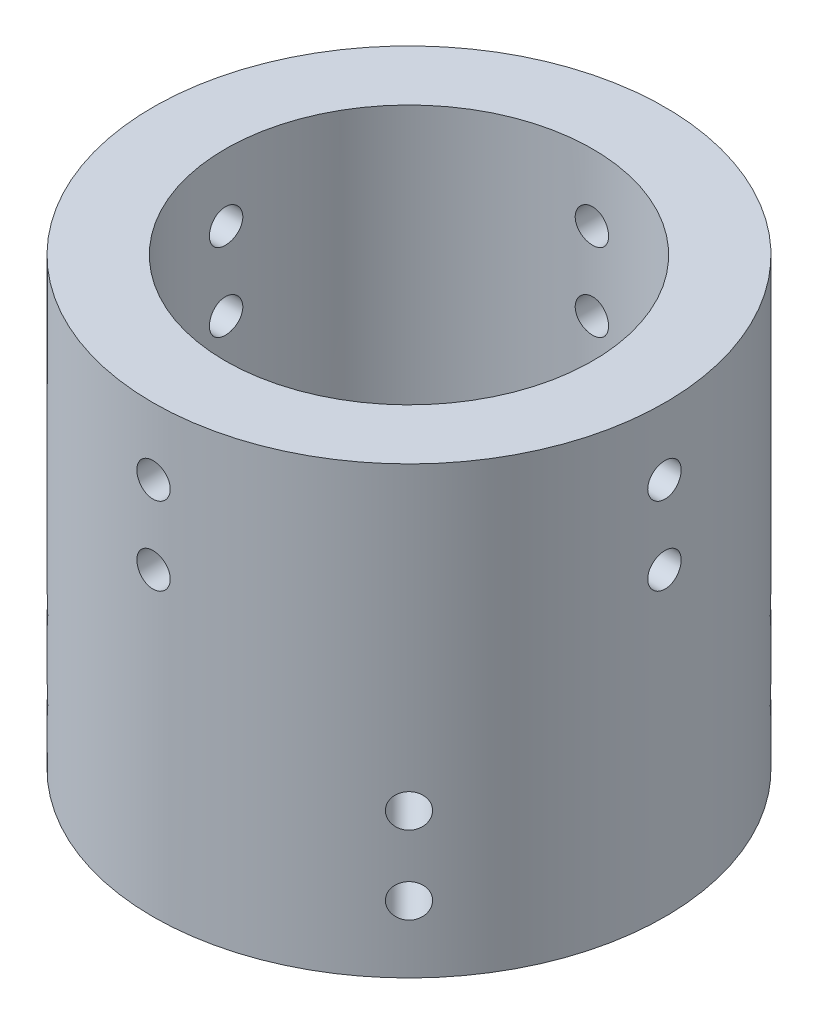
from build123d import *

# Parameters (mm, degrees)
SKETCH_1_R               = 23
EXTRUDE_1_DEPTH          = 5
SKETCH_2_R               = 23
SKETCH_2_R_2             = 16.5
EXTRUDE_2_DEPTH          = 35
SKETCH_3_R               = 1.5
CUT_EXTRUDE_1_DEPTH      = 52.555795019
SKETCH_4_R               = 1.5
CUT_EXTRUDE_2_DEPTH      = 52.555795187
PATTERN_CIRCULAR_1_COUNT = 4


with BuildPart() as part:
    # Эскиз1 → Бобышка-Вытянуть1 (new body)
    with BuildSketch(Plane(origin=(0, 0, 0), x_dir=(1, 0, 0), z_dir=(0, 1, 0))):
        Circle(SKETCH_1_R)
    extrude(amount=EXTRUDE_1_DEPTH)

    # Эскиз2 → Бобышка-Вытянуть2 (add)
    with BuildSketch(Plane(origin=(0, 5, 0), x_dir=(1, 0, 0), z_dir=(0, 1, 0))):
        Circle(SKETCH_2_R)
        Circle(SKETCH_2_R_2, mode=Mode.SUBTRACT)
    extrude(amount=EXTRUDE_2_DEPTH)

    # Эскиз3 → Вырез-Вытянуть1 (cut, through all)
    with BuildSketch(Plane(origin=(0, 0, 0), x_dir=(0, 0, -1), z_dir=(1, 0, 0))):
        with Locations((0, 27)):
            Circle(SKETCH_3_R)
        with Locations((0, 34)):
            Circle(SKETCH_3_R)
    cut_extrude_1 = extrude(amount=-CUT_EXTRUDE_1_DEPTH, mode=Mode.SUBTRACT)

    # Эскиз4 → Вырез-Вытянуть2 (cut, through all)
    with BuildSketch(Plane(origin=(0, 0, 0), x_dir=(0, -1, 0), z_dir=(0.7071067811865464, 0, 0.7071067811865488))):
        with Locations((-13, 0)):
            Circle(SKETCH_4_R)
        with Locations((-6, 0)):
            Circle(SKETCH_4_R)
    cut_extrude_2 = extrude(amount=-CUT_EXTRUDE_2_DEPTH, mode=Mode.SUBTRACT)

    # Круговой массив1: Вырез-Вытянуть1, Вырез-Вытянуть2 ×4 about axis
    pattern_circular_1_axis = Axis((0, 5, 0), (0, -1, 0))
    add([cut_extrude_1.rotate(pattern_circular_1_axis, i * 360 / PATTERN_CIRCULAR_1_COUNT) for i in range(1, PATTERN_CIRCULAR_1_COUNT)], mode=Mode.SUBTRACT)
    add([cut_extrude_2.rotate(pattern_circular_1_axis, i * 360 / PATTERN_CIRCULAR_1_COUNT) for i in range(1, PATTERN_CIRCULAR_1_COUNT)], mode=Mode.SUBTRACT)


solid = part.part
